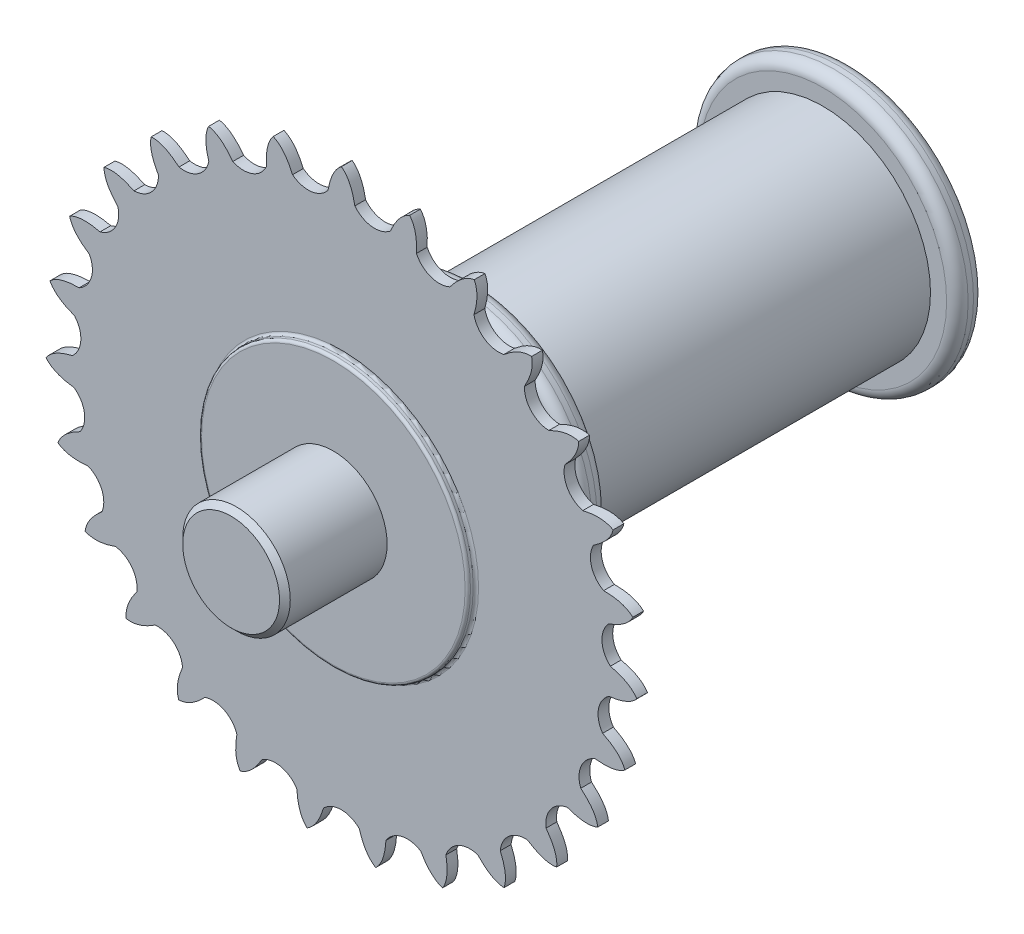
from build123d import *

# Parameters (mm, degrees)
SKETCH1_R                = 25
BOSS_EXTRUDE1_DEPTH      = 37.5
CUT_EXTRUDE1_START       = -32.5
CUT_EXTRUDE1_OUTLINE_R   = 25
CUT_EXTRUDE1_OUTLINE_R_2 = 20
CUT_EXTRUDE1_DEPTH       = 65
BOSS_EXTRUDE2_START      = 37.5
SKETCH3_R                = 10
BOSS_EXTRUDE2_DEPTH      = 40
FILLET1_R                = 2
BOSS_EXTRUDE3_START      = 55
BOSS_EXTRUDE3_DEPTH      = 2
BOSS_EXTRUDE4_START      = 58.5
SKETCH6_R                = 25
BOSS_EXTRUDE4_DEPTH      = 5
FILLET2_R                = 0.5
BOSS_EXTRUDE5_START      = -47.5
SKETCH8_R                = 10
BOSS_EXTRUDE5_DEPTH      = 10
CHAMFER1_SIZE            = 1
CHAMFER2_SIZE            = 1


# Read off the part's stored shape, not the designer's step: Cut-Extrude1
with BuildPart() as part:
    # Sketch1 → Boss-Extrude1 (new, symmetric)
    with BuildSketch(Plane.XY):
        Circle(SKETCH1_R)
    extrude(amount=BOSS_EXTRUDE1_DEPTH, both=True)

    # Cut-Extrude1 outline → Cut-Extrude1 (cut)
    with BuildSketch(Plane.XY.offset(CUT_EXTRUDE1_START)):
        Circle(CUT_EXTRUDE1_OUTLINE_R)
        Circle(CUT_EXTRUDE1_OUTLINE_R_2, mode=Mode.SUBTRACT)
    extrude(amount=CUT_EXTRUDE1_DEPTH, mode=Mode.SUBTRACT)

    # Sketch3 → Boss-Extrude2 (add)
    with BuildSketch(Plane.XY.offset(BOSS_EXTRUDE2_START)):
        Circle(SKETCH3_R)
    extrude(amount=BOSS_EXTRUDE2_DEPTH)

    # Fillet1
    fillet1_edges = [part.edges().sort_by_distance(p)[0] for p in [
        (-25, 0, 37.5),
        (-25, 0, 32.5),
        (-25, 0, -32.5),
        (-25, 0, -37.5),
    ]]
    fillet(fillet1_edges, radius=FILLET1_R)

    # Sketch5 → Boss-Extrude3 (add)
    with BuildSketch(Plane.XY.offset(BOSS_EXTRUDE3_START)):
        with BuildLine():
            ThreePointArc((-38.563099087, 31.825891799), (-35.290139922, 33.294529849), (-34.014292226, 36.647345393))
            add(Edge.make_bspline(
                [(-34.014292226, 36.647345393), (-35.896546566, 39.903938041), (-35.353318533, 42.132444372)],
                knots=[0, 0, 0, 1, 1, 1], degree=2))
            add(Edge.make_bspline(
                [(-30.184070011, 39.861283441), (-33.064337663, 42.280443487), (-35.353318533, 42.132444372)],
                knots=[0, 0, 0, 1, 1, 1], degree=2))
            ThreePointArc((-30.184070011, 39.861283441), (-26.660642641, 40.535537835), (-24.645973109, 43.503747074))
            add(Edge.make_bspline(
                [(-24.645973109, 43.503747074), (-25.72646909, 47.10663557), (-24.683954911, 49.149795218)],
                knots=[0, 0, 0, 1, 1, 1], degree=2))
            add(Edge.make_bspline(
                [(-20.177809907, 45.747742975), (-22.422542872, 48.765929682), (-24.683954911, 49.149795218)],
                knots=[0, 0, 0, 1, 1, 1], degree=2))
            ThreePointArc((-20.177809907, 45.747742975), (-16.593863215, 45.591264483), (-13.948983202, 48.014850491))
            add(Edge.make_bspline(
                [(-13.948983202, 48.014850491), (-14.169471007, 51.769802182), (-12.683872891, 53.517467882)],
                knots=[0, 0, 0, 1, 1, 1], degree=2))
            add(Edge.make_bspline(
                [(-9.083758849, 49.167929844), (-10.571942991, 52.622431985), (-12.683872891, 53.517467882)],
                knots=[0, 0, 0, 1, 1, 1], degree=2))
            ThreePointArc((-9.083758849, 49.167929844), (-5.632504327, 48.189154263), (-2.5, 49.937460889))
            add(Edge.make_bspline(
                [(-2.5, 49.937460889), (-1.848593073, 53.642045358), (0, 55)],
                knots=[0, 0, 0, 1, 1, 1], degree=2))
            add(Edge.make_bspline(
                [(2.5, 49.937460889), (1.848593073, 53.642045358), (0, 55)],
                knots=[0, 0, 0, 1, 1, 1], degree=2))
            ThreePointArc((2.5, 49.937460889), (5.632504327, 48.189154263), (9.083758849, 49.167929844))
            add(Edge.make_bspline(
                [(9.083758849, 49.167929844), (10.571942991, 52.622431985), (12.683872891, 53.517467882)],
                knots=[0, 0, 0, 1, 1, 1], degree=2))
            add(Edge.make_bspline(
                [(13.948983202, 48.014850491), (14.169471007, 51.769802182), (12.683872891, 53.517467882)],
                knots=[0, 0, 0, 1, 1, 1], degree=2))
            ThreePointArc((13.948983202, 48.014850491), (16.593863215, 45.591264483), (20.177809907, 45.747742975))
            add(Edge.make_bspline(
                [(20.177809907, 45.747742975), (22.422542872, 48.765929682), (24.683954911, 49.149795218)],
                knots=[0, 0, 0, 1, 1, 1], degree=2))
            add(Edge.make_bspline(
                [(24.645973109, 43.503747074), (25.72646909, 47.10663557), (24.683954911, 49.149795218)],
                knots=[0, 0, 0, 1, 1, 1], degree=2))
            ThreePointArc((24.645973109, 43.503747074), (26.660642641, 40.535537835), (30.184070011, 39.861283441))
            add(Edge.make_bspline(
                [(30.184070011, 39.861283441), (33.064337663, 42.280443487), (35.353318533, 42.132444372)],
                knots=[0, 0, 0, 1, 1, 1], degree=2))
            add(Edge.make_bspline(
                [(34.014292226, 36.647345393), (35.896546566, 39.903938041), (35.353318533, 42.132444372)],
                knots=[0, 0, 0, 1, 1, 1], degree=2))
            ThreePointArc((34.014292226, 36.647345393), (35.290139922, 33.294529849), (38.563099087, 31.825891799))
            add(Edge.make_bspline(
                [(38.563099087, 31.825891799), (41.923625453, 33.51560764), (44.116775602, 32.843722544)],
                knots=[0, 0, 0, 1, 1, 1], degree=2))
            add(Edge.make_bspline(
                [(41.548892045, 27.815275836), (44.131431925, 30.550008884), (44.116775602, 32.843722544)],
                knots=[0, 0, 0, 1, 1, 1], degree=2))
            ThreePointArc((41.548892045, 27.815275836), (42.017136625, 24.258605141), (44.86318151, 22.074758093))
            add(Edge.make_bspline(
                [(44.86318151, 22.074758093), (48.522799742, 22.943936711), (50.501885878, 21.784387132)],
                knots=[0, 0, 0, 1, 1, 1], degree=2))
            add(Edge.make_bspline(
                [(46.84358034, 17.483677558), (49.987180366, 19.54912084), (50.501885878, 21.784387132)],
                knots=[0, 0, 0, 1, 1, 1], degree=2))
            ThreePointArc((46.84358034, 17.483677558), (46.478978617, 13.914892751), (48.744678205, 11.133568463))
            add(Edge.make_bspline(
                [(48.744678205, 11.133568463), (52.506097338, 11.135352214), (54.164426416, 9.550649772)],
                knots=[0, 0, 0, 1, 1, 1], degree=2))
            add(Edge.make_bspline(
                [(49.612919093, 6.209529698), (53.148106975, 7.494334632), (54.164426416, 9.550649772)],
                knots=[0, 0, 0, 1, 1, 1], degree=2))
            ThreePointArc((49.612919093, 6.209529698), (48.435126841, 2.821024891), (49.998336681, -0.407834724))
            add(Edge.make_bspline(
                [(49.998336681, -0.407834724), (53.658777636, -1.273542003), (54.906948705, -3.19796559)],
                knots=[0, 0, 0, 1, 1, 1], degree=2))
            add(Edge.make_bspline(
                [(49.707612536, -5.399375515), (53.44380538, -4.964473096), (54.906948705, -3.19796559)],
                knots=[0, 0, 0, 1, 1, 1], degree=2))
            ThreePointArc((49.707612536, -5.399375515), (47.780124841, -8.424925151), (48.556571885, -11.927251435))
            add(Edge.make_bspline(
                [(48.556571885, -11.927251435), (51.918699342, -13.613779241), (52.689423177, -15.774177799)],
                knots=[0, 0, 0, 1, 1, 1], degree=2))
            add(Edge.make_bspline(
                [(47.122555721, -16.717198997), (50.858334403, -17.155644795), (52.689423177, -15.774177799)],
                knots=[0, 0, 0, 1, 1, 1], degree=2))
            ThreePointArc((47.122555721, -16.717198997), (44.549283942, -19.216685298), (44.49710973, -22.803666935))
            add(Edge.make_bspline(
                [(44.49710973, -22.803666935), (47.379670528, -25.220094116), (47.631397208, -27.5)],
                knots=[0, 0, 0, 1, 1, 1], degree=2))
            add(Edge.make_bspline(
                [(41.99710973, -27.133793954), (45.531077455, -28.421951242), (47.631397208, -27.5)],
                knots=[0, 0, 0, 1, 1, 1], degree=2))
            ThreePointArc((41.99710973, -27.133793954), (38.916779615, -28.972468966), (38.038796872, -32.450730847))
            add(Edge.make_bspline(
                [(38.038796872, -32.450730847), (40.286391412, -35.46678719), (40.005550287, -37.743290083)],
                knots=[0, 0, 0, 1, 1, 1], degree=2))
            add(Edge.make_bspline(
                [(34.607588683, -36.087599055), (37.749228335, -38.156022941), (40.005550287, -37.743290083)],
                knots=[0, 0, 0, 1, 1, 1], degree=2))
            ThreePointArc((34.607588683, -36.087599055), (31.186261626, -37.166339332), (29.529802629, -40.34836746))
            add(Edge.make_bspline(
                [(29.529802629, -40.34836746), (31.021262508, -43.801456586), (30.222993794, -45.951829628)],
                knots=[0, 0, 0, 1, 1, 1], degree=2))
            add(Edge.make_bspline(
                [(25.352363572, -43.095912351), (27.932308545, -45.833093567), (30.222993794, -45.951829628)],
                knots=[0, 0, 0, 1, 1, 1], degree=2))
            ThreePointArc((25.352363572, -43.095912351), (21.7744842, -43.356562726), (19.428849082, -46.070813139))
            add(Edge.make_bspline(
                [(19.428849082, -46.070813139), (20.083769312, -49.774778119), (18.811107883, -51.683094143)],
                knots=[0, 0, 0, 1, 1, 1], degree=2))
            add(Edge.make_bspline(
                [(14.730385978, -47.780913856), (16.609550772, -51.039290255), (18.811107883, -51.683094143)],
                knots=[0, 0, 0, 1, 1, 1], degree=2))
            ThreePointArc((14.730385978, -47.780913856), (11.188838695, -47.2094226), (8.280481253, -49.309569357))
            add(Edge.make_bspline(
                [(8.280481253, -49.309569357), (8.063554914, -53.064728481), (6.385110277, -54.628109676)],
                knots=[0, 0, 0, 1, 1, 1], degree=2))
            add(Edge.make_bspline(
                [(3.314289464, -49.890033928), (4.391367817, -53.493945595), (6.385110277, -54.628109676)],
                knots=[0, 0, 0, 1, 1, 1], degree=2))
            ThreePointArc((3.314289464, -49.890033928), (0, -48.517210282), (-3.314289464, -49.890033928))
            add(Edge.make_bspline(
                [(-3.314289464, -49.890033928), (-4.391367817, -53.493945595), (-6.385110277, -54.628109676)],
                knots=[0, 0, 0, 1, 1, 1], degree=2))
            add(Edge.make_bspline(
                [(-8.280481253, -49.309569357), (-8.063554914, -53.064728481), (-6.385110277, -54.628109676)],
                knots=[0, 0, 0, 1, 1, 1], degree=2))
            ThreePointArc((-8.280481253, -49.309569357), (-11.188838695, -47.2094226), (-14.730385978, -47.780913856))
            add(Edge.make_bspline(
                [(-14.730385978, -47.780913856), (-16.609550772, -51.039290255), (-18.811107883, -51.683094143)],
                knots=[0, 0, 0, 1, 1, 1], degree=2))
            add(Edge.make_bspline(
                [(-19.428849082, -46.070813139), (-20.083769312, -49.774778119), (-18.811107883, -51.683094143)],
                knots=[0, 0, 0, 1, 1, 1], degree=2))
            ThreePointArc((-19.428849082, -46.070813139), (-21.7744842, -43.356562726), (-25.352363572, -43.095912351))
            add(Edge.make_bspline(
                [(-25.352363572, -43.095912351), (-27.932308545, -45.833093567), (-30.222993794, -45.951829628)],
                knots=[0, 0, 0, 1, 1, 1], degree=2))
            add(Edge.make_bspline(
                [(-29.529802629, -40.34836746), (-31.021262508, -43.801456586), (-30.222993794, -45.951829628)],
                knots=[0, 0, 0, 1, 1, 1], degree=2))
            ThreePointArc((-29.529802629, -40.34836746), (-31.186261626, -37.166339332), (-34.607588683, -36.087599055))
            add(Edge.make_bspline(
                [(-34.607588683, -36.087599055), (-37.749228335, -38.156022941), (-40.005550287, -37.743290083)],
                knots=[0, 0, 0, 1, 1, 1], degree=2))
            add(Edge.make_bspline(
                [(-38.038796872, -32.450730847), (-40.286391412, -35.46678719), (-40.005550287, -37.743290083)],
                knots=[0, 0, 0, 1, 1, 1], degree=2))
            ThreePointArc((-38.038796872, -32.450730847), (-38.916779615, -28.972468966), (-41.99710973, -27.133793954))
            add(Edge.make_bspline(
                [(-41.99710973, -27.133793954), (-45.531077455, -28.421951242), (-47.631397208, -27.5)],
                knots=[0, 0, 0, 1, 1, 1], degree=2))
            add(Edge.make_bspline(
                [(-44.49710973, -22.803666935), (-47.379670528, -25.220094116), (-47.631397208, -27.5)],
                knots=[0, 0, 0, 1, 1, 1], degree=2))
            ThreePointArc((-44.49710973, -22.803666935), (-44.549283942, -19.216685298), (-47.122555721, -16.717198997))
            add(Edge.make_bspline(
                [(-47.122555721, -16.717198997), (-50.858334403, -17.155644795), (-52.689423177, -15.774177799)],
                knots=[0, 0, 0, 1, 1, 1], degree=2))
            add(Edge.make_bspline(
                [(-48.556571885, -11.927251435), (-51.918699342, -13.613779241), (-52.689423177, -15.774177799)],
                knots=[0, 0, 0, 1, 1, 1], degree=2))
            ThreePointArc((-48.556571885, -11.927251435), (-47.780124841, -8.424925151), (-49.707612536, -5.399375515))
            add(Edge.make_bspline(
                [(-49.707612536, -5.399375515), (-53.44380538, -4.964473096), (-54.906948705, -3.19796559)],
                knots=[0, 0, 0, 1, 1, 1], degree=2))
            add(Edge.make_bspline(
                [(-49.998336681, -0.407834724), (-53.658777636, -1.273542003), (-54.906948705, -3.19796559)],
                knots=[0, 0, 0, 1, 1, 1], degree=2))
            ThreePointArc((-49.998336681, -0.407834724), (-48.435126841, 2.821024891), (-49.612919093, 6.209529698))
            add(Edge.make_bspline(
                [(-49.612919093, 6.209529698), (-53.148106975, 7.494334632), (-54.164426416, 9.550649772)],
                knots=[0, 0, 0, 1, 1, 1], degree=2))
            add(Edge.make_bspline(
                [(-48.744678205, 11.133568463), (-52.506097338, 11.135352214), (-54.164426416, 9.550649772)],
                knots=[0, 0, 0, 1, 1, 1], degree=2))
            ThreePointArc((-48.744678205, 11.133568463), (-46.478978617, 13.914892751), (-46.84358034, 17.483677558))
            add(Edge.make_bspline(
                [(-46.84358034, 17.483677558), (-49.987180366, 19.54912084), (-50.501885878, 21.784387132)],
                knots=[0, 0, 0, 1, 1, 1], degree=2))
            add(Edge.make_bspline(
                [(-44.86318151, 22.074758093), (-48.522799742, 22.943936711), (-50.501885878, 21.784387132)],
                knots=[0, 0, 0, 1, 1, 1], degree=2))
            ThreePointArc((-44.86318151, 22.074758093), (-42.017136625, 24.258605141), (-41.548892045, 27.815275836))
            add(Edge.make_bspline(
                [(-41.548892045, 27.815275836), (-44.131431925, 30.550008884), (-44.116775602, 32.843722544)],
                knots=[0, 0, 0, 1, 1, 1], degree=2))
            add(Edge.make_bspline(
                [(-38.563099087, 31.825891799), (-41.923625453, 33.51560764), (-44.116775602, 32.843722544)],
                knots=[0, 0, 0, 1, 1, 1], degree=2))
        make_face()
    extrude(amount=BOSS_EXTRUDE3_DEPTH)

    # Sketch6 → Boss-Extrude4 (add)
    with BuildSketch(Plane.XY.offset(BOSS_EXTRUDE4_START)):
        Circle(SKETCH6_R)
    extrude(amount=-BOSS_EXTRUDE4_DEPTH)

    # Fillet2
    fillet2_edges = [part.edges().sort_by_distance(p)[0] for p in [
        (-25, 0, 55),
        (-25, 0, 57),
        (-25, 0, 53.5),
        (-25, 0, 58.5),
    ]]
    fillet(fillet2_edges, radius=FILLET2_R)

    # Sketch8 → Boss-Extrude5 (add)
    with BuildSketch(Plane.XY.offset(BOSS_EXTRUDE5_START)):
        Circle(SKETCH8_R)
    extrude(amount=BOSS_EXTRUDE5_DEPTH)

    # Chamfer1
    chamfer1_edges = [part.edges().sort_by_distance(p)[0] for p in [
        (-10, 0, -47.5),
    ]]
    chamfer(chamfer1_edges, length=CHAMFER1_SIZE)

    # Chamfer2
    chamfer2_edges = [part.edges().sort_by_distance(p)[0] for p in [
        (-10, 0, 77.5),
    ]]
    chamfer(chamfer2_edges, length=CHAMFER2_SIZE)


solid = part.part
